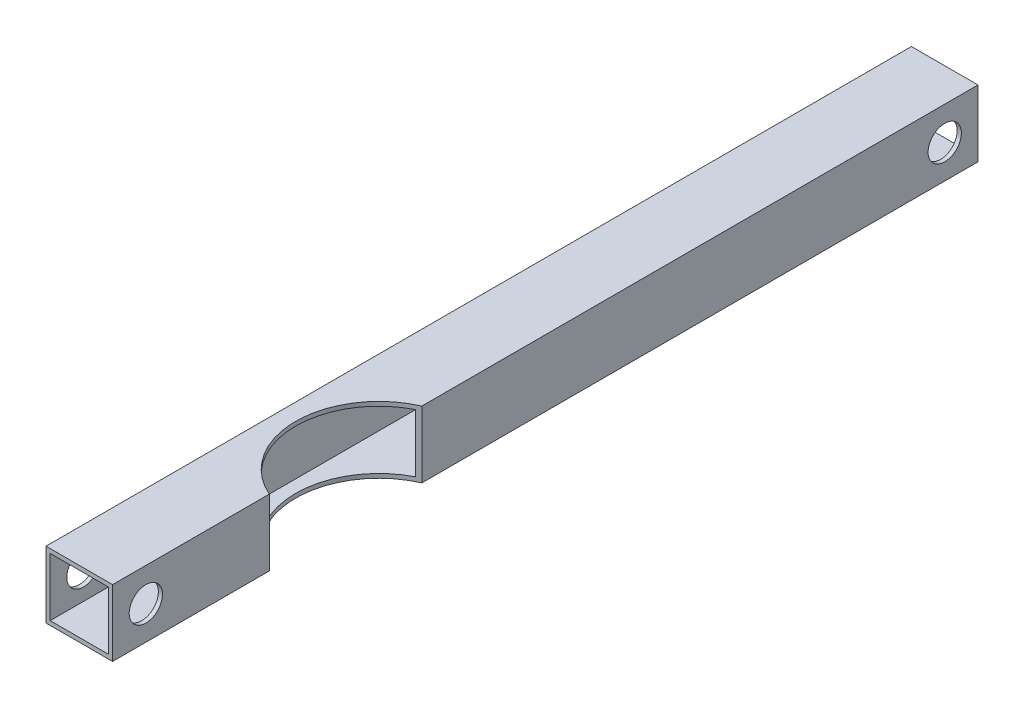
from build123d import *

# Parameters (mm, degrees)
SKETCH1_W           = 25.4
SKETCH1_H           = 25.4
SKETCH1_W_2         = 22.225
SKETCH1_H_2         = 22.225
EXTRUDE_THIN1_DEPTH = 165.1
SKETCH2_R           = 6.35
CUT_EXTRUDE1_DEPTH  = 168.52450567
SKETCH3_R           = 31.75
CUT_EXTRUDE2_DEPTH  = 168.52450567


with BuildPart() as part:
    # Sketch1 → Extrude-Thin1 (new, symmetric)
    with BuildSketch(Plane.XY):
        Rectangle(SKETCH1_W, SKETCH1_H)
        Rectangle(SKETCH1_W_2, SKETCH1_H_2, mode=Mode.SUBTRACT)
    extrude(amount=EXTRUDE_THIN1_DEPTH, both=True)

    # Sketch2 → Cut-Extrude1 (cut, through all)
    with BuildSketch(Plane(origin=(12.7, 0, 0), x_dir=(0, 0, -1), z_dir=(1, 0, 0))):
        with Locations((-152.4, 0)):
            Circle(SKETCH2_R)
        with Locations((152.4, 0)):
            Circle(SKETCH2_R)
    extrude(amount=-CUT_EXTRUDE1_DEPTH, mode=Mode.SUBTRACT)

    # Sketch3 → Cut-Extrude2 (cut, through all)
    with BuildSketch(Plane.XZ.offset(12.7)):
        with Locations((25.4, 76.2)):
            Circle(SKETCH3_R)
    extrude(amount=-CUT_EXTRUDE2_DEPTH, mode=Mode.SUBTRACT)


solid = part.part
